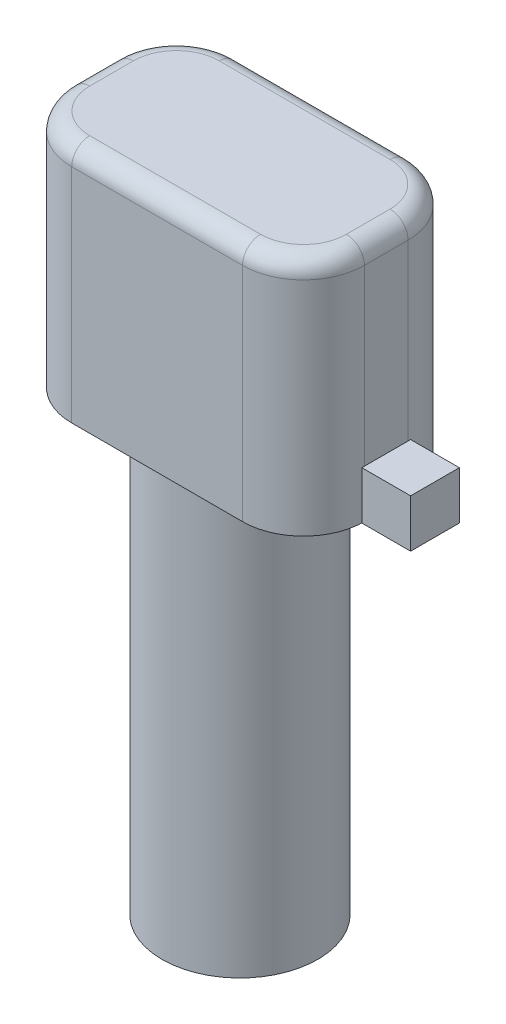
from build123d import *

# Parameters (mm, degrees)
SKETCH1_R           = 3.25
BOSS_EXTRUDE1_DEPTH = 17.686
SKETCH3_W           = 12.2
SKETCH3_H           = 6.9
BOSS_EXTRUDE2_DEPTH = 10
FILLET1_R           = 2.54
FILLET2_R           = 0.75
SKETCH5_W           = 2.032
SKETCH5_H           = 2.032
BOSS_EXTRUDE3_DEPTH = 2


with BuildPart() as part:
    # Sketch1 → Boss-Extrude1 (new body)
    with BuildSketch(Plane(origin=(0, 0, 0), x_dir=(1, 0, 0), z_dir=(0, 1, 0))):
        Circle(SKETCH1_R)
    extrude(amount=BOSS_EXTRUDE1_DEPTH)

    # Sketch3 → Boss-Extrude2 (add)
    with BuildSketch(Plane(origin=(0, 17.686, 0), x_dir=(1, 0, 0), z_dir=(0, 1, 0))):
        Rectangle(SKETCH3_W, SKETCH3_H)
    extrude(amount=BOSS_EXTRUDE2_DEPTH)

    # Fillet1
    fillet1_edges = [part.edges().sort_by_distance(p)[0] for p in [
        (-6.1, 22.686, -3.45),
        (6.1, 22.686, -3.45),
        (6.1, 22.686, 3.45),
        (-6.1, 22.686, 3.45),
    ]]
    fillet(fillet1_edges, radius=FILLET1_R)

    # Fillet2
    fillet2_edges = [part.edges().sort_by_distance(p)[0] for p in [
        (6.1, 27.686, 0),
        (5.356051224, 27.686, 2.706051224),
        (5.356051224, 27.686, -2.706051224),
        (0, 27.686, -3.45),
        (-5.356051224, 27.686, -2.706051224),
        (-6.1, 27.686, 0),
        (-5.356051224, 27.686, 2.706051224),
        (0, 27.686, 3.45),
    ]]
    fillet(fillet2_edges, radius=FILLET2_R)

    # Sketch5 → Boss-Extrude3 (add)
    with BuildSketch(Plane.XZ.offset(-17.686)):
        with Locations((7.116, 0)):
            Rectangle(SKETCH5_W, SKETCH5_H)
    extrude(amount=-BOSS_EXTRUDE3_DEPTH)


solid = part.part
